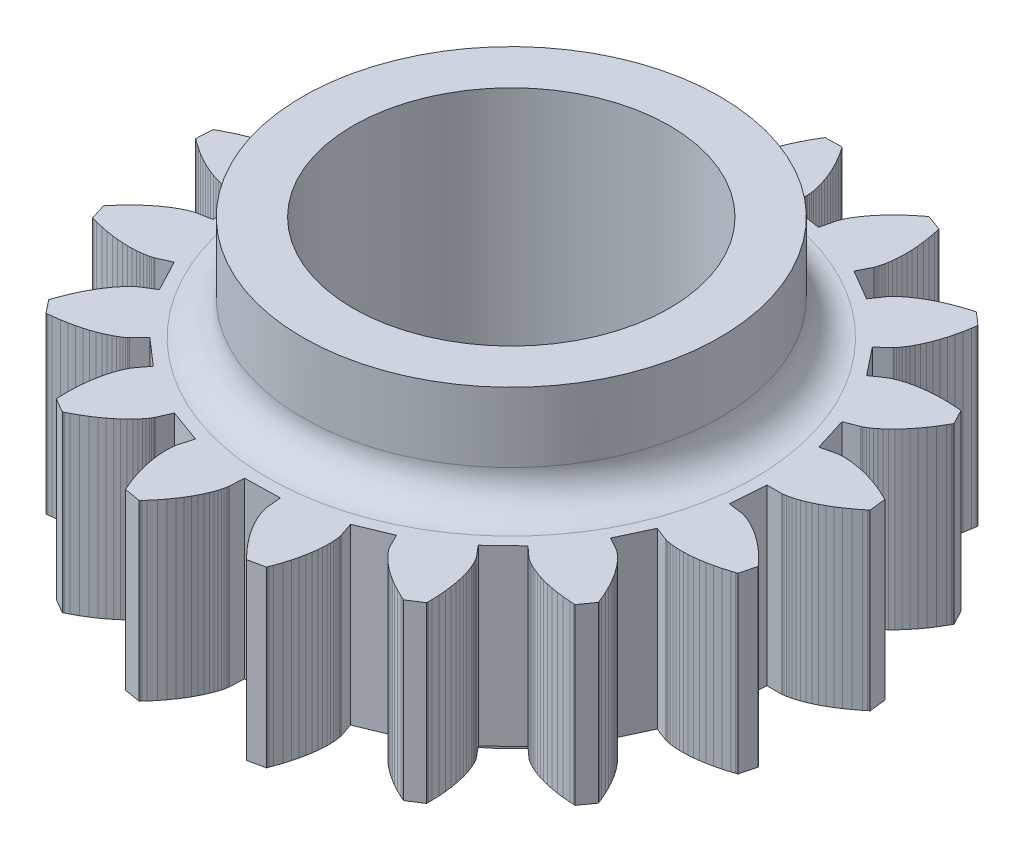
from build123d import *

# Parameters (mm, degrees)
BOSS_EXTRUDE1_DEPTH     = 5
SKETCH3_R               = 6
BOSS_EXTRUDE2_DEPTH     = 3
BOSS_EXTRUDE3_START     = -6
SKETCH3_2_R             = 6
BOSS_EXTRUDE3_DEPTH     = 1
CUT_EXTRUDE1_DEPTH      = 15.70772094
CUT_EXTRUDE1_DEPTH_BACK = 15.70772094
SKETCH2_R               = 4.55


with BuildPart() as part:
    # Sketch1 → Boss-Extrude1 (new body)
    with BuildSketch(Plane(origin=(0, 0, 0), x_dir=(1, 0, 0), z_dir=(0, 1, 0))):
        Polygon((7.35, 0), (7.766319, 1.4e-05), (7.778421, 0.000519), (7.803546, 0.002554), (7.841567, 0.007188), (7.89229, 0.015481), (7.955458, 0.02848), (8.030748, 0.047216), (8.117774, 0.072701), (8.216087, 0.105924), (8.325179, 0.147849), (8.444479, 0.199407), (8.573361, 0.2615), (8.711141, 0.334991), (8.85708, 0.420705), (9.010389, 0.519425), (9.170226, 0.631889), (9.335704, 0.758787), (9.420269, 0.82785), (9.44158, 0.845714), (9.45226, 0.854736), (9.457605, 0.85927), (9.46028, 0.861542), (9.405526, 1.336443), (9.401764, 1.33846), (9.395519, 1.341643), (9.383051, 1.347968), (9.358203, 1.360453), (9.260024, 1.40822), (9.069801, 1.493667), (8.888386, 1.566364), (8.716486, 1.627187), (8.554748, 1.677047), (8.403761, 1.716887), (8.264055, 1.747681), (8.136096, 1.770425), (8.020287, 1.786142), (7.916969, 1.795868), (7.826415, 1.800659), (7.748834, 1.801581), (7.68437, 1.799707), (7.633099, 1.796114), (7.595031, 1.791881), (7.570112, 1.788085), (7.558218, 1.785793), (7.153051, 1.690077), (6.853671, 2.655126), (7.241872, 2.805531), (7.252974, 2.810373), (7.275668, 2.821347), (7.309447, 2.839403), (7.353749, 2.86546), (7.407956, 2.900399), (7.471393, 2.945068), (7.543336, 3.00027), (7.623009, 3.066764), (7.709589, 3.145266), (7.802208, 3.236439), (7.899957, 3.340896), (8.001884, 3.459197), (8.107005, 3.591842), (8.214299, 3.739278), (8.322716, 3.901887), (8.43118, 4.079993), (8.485085, 4.174941), (8.498504, 4.199296), (8.505203, 4.211567), (8.50855, 4.217726), (8.510223, 4.220811), (8.287613, 4.643864), (8.283376, 4.644386), (8.276403, 4.645098), (8.262492, 4.646492), (8.234812, 4.649157), (8.126008, 4.658233), (7.917763, 4.669193), (7.722337, 4.671446), (7.540073, 4.666064), (7.371245, 4.654131), (7.216063, 4.636738), (7.074667, 4.614985), (6.947132, 4.589969), (6.833466, 4.562789), (6.733611, 4.534536), (6.647441, 4.506292), (6.574766, 4.479126), (6.515332, 4.454091), (6.468822, 4.432219), (6.434854, 4.414521), (6.412988, 4.401979), (6.402725, 4.395546), (6.059495, 4.15993), (5.431716, 4.951663), (5.73937, 5.232145), (5.747973, 5.240672), (5.76517, 5.259102), (5.790145, 5.288141), (5.822043, 5.328442), (5.859968, 5.380604), (5.902985, 5.445173), (5.950129, 5.522635), (6.000401, 5.613421), (6.052777, 5.717898), (6.106206, 5.836372), (6.159619, 5.969087), (6.211929, 6.116219), (6.262034, 6.277881), (6.308823, 6.45412), (6.351178, 6.644913), (6.387977, 6.850174), (6.403944, 6.958183), (6.407658, 6.985741), (6.409472, 6.999604), (6.410369, 7.006555), (6.410814, 7.010037), (6.050412, 7.324105), (6.046273, 7.323062), (6.039513, 7.321207), (6.026038, 7.317481), (5.999265, 7.309968), (5.894529, 7.279125), (5.696387, 7.214119), (5.513344, 7.145624), (5.345332, 7.074764), (5.192216, 7.002649), (5.053795, 6.930372), (4.929806, 6.85901), (4.81992, 6.789613), (4.723748, 6.723207), (4.640842, 6.66079), (4.570694, 6.603325), (4.51274, 6.55174), (4.466363, 6.506926), (4.430894, 6.469729), (4.405613, 6.440956), (4.389755, 6.421362), (4.382509, 6.411655), (4.147571, 6.067961), (3.276177, 6.57945), (3.461734, 6.95213), (3.466676, 6.963188), (3.476054, 6.986586), (3.488853, 7.022687), (3.504038, 7.071789), (3.520559, 7.134128), (3.537347, 7.209876), (3.553324, 7.299139), (3.567406, 7.401954), (3.578503, 7.518296), (3.585527, 7.648071), (3.587391, 7.791119), (3.583018, 7.947212), (3.571341, 8.116057), (3.551305, 8.297297), (3.521877, 8.490507), (3.482043, 8.6952), (3.457914, 8.801683), (3.451423, 8.828723), (3.448107, 8.842304), (3.446431, 8.849111), (3.445589, 8.852518), (2.996069, 9.015186), (2.992586, 9.012717), (2.986953, 9.008546), (2.975734, 9.000204), (2.953483, 8.983526), (2.866961, 8.916932), (2.705682, 8.784738), (2.559743, 8.654746), (2.428674, 8.527978), (2.311948, 8.40542), (2.208984, 8.288021), (2.119147, 8.176687), (2.04175, 8.072281), (1.976061, 7.975619), (1.921301, 7.887467), (1.876649, 7.808542), (1.841243, 7.739505), (1.814187, 7.680964), (1.79455, 7.633467), (1.78137, 7.597503), (1.773661, 7.573504), (1.770411, 7.561835), (1.675494, 7.156481), (0.678172, 7.318646), (0.716572, 7.733191), (0.717186, 7.745288), (0.717477, 7.770493), (0.716371, 7.808779), (0.712794, 7.860051), (0.705679, 7.924149), (0.69397, 8.000847), (0.676623, 8.089853), (0.652613, 8.190812), (0.620933, 8.303307), (0.580602, 8.426856), (0.530666, 8.560917), (0.470201, 8.70489), (0.398318, 8.858115), (0.314164, 9.019878), (0.216928, 9.189411), (0.10584, 9.365892), (0.044874, 9.456468), (0.029053, 9.479336), (0.021055, 9.490803), (0.017034, 9.496544), (0.015018, 9.499417), (-0.46291, 9.488715), (-0.465265, 9.485155), (-0.469011, 9.479231), (-0.476459, 9.467399), (-0.491183, 9.44381), (-0.547806, 9.350457), (-0.65044, 9.168929), (-0.739565, 8.994996), (-0.81599, 8.829441), (-0.88056, 8.672993), (-0.934162, 8.526327), (-0.977715, 8.390058), (-1.012169, 8.264743), (-1.038503, 8.150879), (-1.057722, 8.048898), (-1.070848, 7.959172), (-1.078924, 7.882008), (-1.083005, 7.817646), (-1.084158, 7.766262), (-1.083456, 7.727966), (-1.081975, 7.702802), (-1.080791, 7.690748), (-1.022867, 7.278478), (-2.011423, 7.069418), (-2.125367, 7.469841), (-2.129165, 7.481343), (-2.137998, 7.504952), (-2.15286, 7.540253), (-2.174718, 7.58677), (-2.204507, 7.64397), (-2.243132, 7.711258), (-2.29146, 7.787987), (-2.35032, 7.873456), (-2.420498, 7.96691), (-2.502736, 8.067546), (-2.597729, 8.174516), (-2.70612, 8.286924), (-2.8285, 8.403835), (-2.965407, 8.524275), (-3.117319, 8.647234), (-3.284657, 8.771668), (-3.374226, 8.834104), (-3.39724, 8.849713), (-3.40884, 8.857516), (-3.414664, 8.861417), (-3.417582, 8.863367), (-3.85937, 8.680741), (-3.86028, 8.676571), (-3.861633, 8.669693), (-3.864304, 8.65597), (-3.869512, 8.628654), (-3.888588, 8.521151), (-3.918716, 8.314806), (-3.938992, 8.120422), (-3.95045, 7.938439), (-3.954144, 7.76923), (-3.951145, 7.613105), (-3.94253, 7.470305), (-3.929389, 7.341006), (-3.912813, 7.225317), (-3.893893, 7.123281), (-3.87372, 7.034872), (-3.853376, 6.960001), (-3.833931, 6.898511), (-3.816445, 6.85018), (-3.801956, 6.814724), (-3.791485, 6.791795), (-3.786026, 6.780982), (-3.583085, 6.417476), (-4.429365, 5.865427), (-4.680264, 6.197648), (-4.68796, 6.207002), (-4.704725, 6.225825), (-4.731336, 6.253374), (-4.768521, 6.288854), (-4.816962, 6.33143), (-4.877286, 6.380221), (-4.950068, 6.434311), (-5.035828, 6.492746), (-5.135027, 6.554538), (-5.248066, 6.61867), (-5.375286, 6.684101), (-5.516964, 6.749763), (-5.673313, 6.814571), (-5.844483, 6.877422), (-6.030554, 6.9372), (-6.231544, 6.992782), (-6.337619, 7.018646), (-6.364717, 7.024887), (-6.378353, 7.027973), (-6.385193, 7.029506), (-6.388618, 7.030271), (-6.734601, 6.700385), (-6.733943, 6.696167), (-6.73272, 6.689265), (-6.730253, 6.675504), (-6.725242, 6.648151), (-6.704195, 6.541016), (-6.657748, 6.337722), (-6.606435, 6.14914), (-6.551379, 5.975307), (-6.4937, 5.816189), (-6.434503, 5.671691), (-6.374885, 5.541645), (-6.315923, 5.425825), (-6.258675, 5.323937), (-6.204173, 5.235625), (-6.153426, 5.160474), (-6.107408, 5.098008), (-6.067064, 5.047694), (-6.033299, 5.008944), (-6.006981, 4.981116), (-5.988934, 4.963518), (-5.979937, 4.955407), (-5.659387, 4.689759), (-6.249096, 3.869276), (-6.603065, 4.088428), (-6.61362, 4.09437), (-6.636053, 4.105866), (-6.670819, 4.121942), (-6.71831, 4.141593), (-6.778859, 4.163795), (-6.852735, 4.1875), (-6.940142, 4.211646), (-7.04122, 4.235154), (-7.156042, 4.256939), (-7.284615, 4.275906), (-7.42688, 4.290962), (-7.582711, 4.30101), (-7.751914, 4.304961), (-7.934229, 4.301734), (-8.12933, 4.290259), (-8.336826, 4.269481), (-8.445081, 4.25528), (-8.472604, 4.251311), (-8.486434, 4.249262), (-8.493365, 4.248222), (-8.496835, 4.247698), (-8.700286, 3.815104), (-8.69815, 3.811409), (-8.694516, 3.805415), (-8.687244, 3.793474), (-8.672691, 3.769779), (-8.614364, 3.677481), (-8.497615, 3.504694), (-8.381643, 3.347383), (-8.267509, 3.205176), (-8.156244, 3.07764), (-8.048846, 2.964283), (-7.946277, 2.864556), (-7.849457, 2.777857), (-7.759268, 2.703529), (-7.676545, 2.640869), (-7.602077, 2.589125), (-7.536602, 2.5475), (-7.480806, 2.515158), (-7.435323, 2.491222), (-7.40073, 2.474781), (-7.377544, 2.46489), (-7.366225, 2.460577), (-6.971358, 2.328664), (-7.224852, 1.350559), (-7.634085, 1.427044), (-7.646074, 1.428771), (-7.671145, 1.431387), (-7.70937, 1.433818), (-7.760753, 1.434987), (-7.825234, 1.433817), (-7.902685, 1.429234), (-7.992912, 1.420174), (-8.095656, 1.405581), (-8.210594, 1.384416), (-8.337337, 1.355657), (-8.475434, 1.318304), (-8.624371, 1.271381), (-8.783576, 1.213942), (-8.952414, 1.145073), (-9.130195, 1.063894), (-9.316173, 0.969564), (-9.411988, 0.917216), (-9.436219, 0.903572), (-9.448374, 0.896666), (-9.454462, 0.893192), (-9.457509, 0.891449), (-9.49095, 0.414573), (-9.487623, 0.411899), (-9.482069, 0.407623), (-9.470975, 0.399115), (-9.448845, 0.382277), (-9.361115, 0.317282), (-9.189831, 0.198337), (-9.024863, 0.093543), (-8.867066, 0.002169), (-8.717243, -0.076561), (-8.576148, -0.143467), (-8.444479, -0.199407), (-8.322878, -0.245277), (-8.211929, -0.282005), (-8.112157, -0.310551), (-8.024025, -0.3319), (-7.947935, -0.347061), (-7.884224, -0.357064), (-7.833166, -0.362953), (-7.794969, -0.365788), (-7.769776, -0.366635), (-7.757663, -0.366568), (-7.341808, -0.346931), (-7.224852, -1.350559), (-7.63408, -1.427071), (-7.645883, -1.429791), (-7.670207, -1.436408), (-7.706728, -1.44795), (-7.755064, -1.465422), (-7.814768, -1.489806), (-7.885333, -1.522058), (-7.966194, -1.5631), (-8.056729, -1.613823), (-8.15626, -1.675079), (-8.264055, -1.747681), (-8.379333, -1.832398), (-8.501263, -1.929955), (-8.628967, -2.041026), (-8.761526, -2.166236), (-8.897976, -2.306155), (-9.03732, -2.461298), (-9.107754, -2.544724), (-9.12542, -2.566199), (-9.13426, -2.57703), (-9.138681, -2.582469), (-9.140893, -2.585195), (-8.999808, -3.041949), (-8.99574, -3.04324), (-8.989016, -3.045222), (-8.975598, -3.049148), (-8.94888, -3.056854), (-8.843595, -3.085768), (-8.64091, -3.134806), (-8.449226, -3.17293), (-8.269076, -3.201131), (-8.10093, -3.220423), (-7.945194, -3.231841), (-7.802208, -3.236439), (-7.672249, -3.235284), (-7.555524, -3.229453), (-7.452177, -3.220029), (-7.362285, -3.2081), (-7.285856, -3.19475), (-7.222834, -3.181062), (-7.173096, -3.16811), (-7.136454, -3.156954), (-7.112656, -3.148644), (-7.101386, -3.144206), (-6.720706, -2.97567), (-6.249096, -3.869276), (-6.60305, -4.088452), (-6.613074, -4.095252), (-6.633364, -4.110209), (-6.66325, -4.134164), (-6.702011, -4.167918), (-6.748874, -4.212223), (-6.803024, -4.267787), (-6.863598, -4.335269), (-6.929696, -4.415271), (-7.000378, -4.508345), (-7.074667, -4.614985), (-7.151557, -4.735625), (-7.230011, -4.87064), (-7.308969, -5.020342), (-7.387345, -5.184983), (-7.464036, -5.364745), (-7.537926, -5.559749), (-7.573467, -5.662985), (-7.582182, -5.689391), (-7.586513, -5.702684), (-7.588671, -5.709353), (-7.589748, -5.712693), (-7.293193, -6.087638), (-7.288932, -6.087373), (-7.281947, -6.086792), (-7.268017, -6.085605), (-7.240319, -6.083139), (-7.131699, -6.072068), (-6.924986, -6.044576), (-6.732474, -6.010882), (-6.554302, -5.972101), (-6.390542, -5.929348), (-6.241197, -5.883737), (-6.106206, -5.836372), (-5.985439, -5.788349), (-5.878703, -5.740745), (-5.78574, -5.694625), (-5.706227, -5.651028), (-5.639781, -5.610971), (-5.585959, -5.575441), (-5.544259, -5.545395), (-5.514122, -5.521757), (-5.494933, -5.50541), (-5.486027, -5.497201), (-5.191936, -5.202529), (-4.429365, -5.865427), (-4.680242, -6.197665), (-4.687132, -6.207627), (-4.700649, -6.228903), (-4.719864, -6.262037), (-4.743813, -6.307513), (-4.771507, -6.365755), (-4.801928, -6.437129), (-4.834035, -6.521935), (-4.866769, -6.620413), (-4.899055, -6.732735), (-4.929806, -6.85901), (-4.957923, -6.999279), (-4.982307, -7.153517), (-5.001853, -7.321634), (-5.015462, -7.503469), (-5.022037, -7.698797), (-5.020494, -7.907324), (-5.016342, -8.016428), (-5.014929, -8.0442), (-5.014165, -8.058159), (-5.013769, -8.065158), (-5.013567, -8.068661), (-4.601591, -8.311159), (-4.597714, -8.309372), (-4.591411, -8.306307), (-4.57885, -8.300169), (-4.553913, -8.287863), (-4.456627, -8.238301), (-4.273804, -8.137993), (-4.106464, -8.037031), (-3.954333, -7.936505), (-3.817075, -7.837483), (-3.694292, -7.741002), (-3.585527, -7.648071), (-3.490263, -7.559664), (-3.407931, -7.476718), (-3.337906, -7.40013), (-3.279511, -7.330753), (-3.232023, -7.269398), (-3.194671, -7.216825), (-3.16664, -7.173745), (-3.147077, -7.140816), (-3.135089, -7.118641), (-3.12975, -7.107769), (-2.961966, -6.726757), (-2.011423, -7.069418), (-2.125341, -7.469849), (-2.128167, -7.481627), (-2.133085, -7.50635), (-2.139033, -7.544187), (-2.144938, -7.595244), (-2.149722, -7.659557), (-2.152305, -7.7371), (-2.151609, -7.827778), (-2.146558, -7.931431), (-2.136089, -8.047831), (-2.119147, -8.176687), (-2.094695, -8.317641), (-2.061714, -8.470273), (-2.01921, -8.634098), (-1.966213, -8.80857), (-1.901784, -8.993083), (-1.825016, -9.186972), (-1.781732, -9.287208), (-1.770382, -9.312594), (-1.764627, -9.325335), (-1.761729, -9.331718), (-1.760275, -9.334912), (-1.288519, -9.412211), (-1.285549, -9.409145), (-1.280779, -9.404009), (-1.271283, -9.393748), (-1.252476, -9.373266), (-1.179663, -9.291907), (-1.045422, -9.132329), (-0.925853, -8.977734), (-0.820309, -8.82904), (-0.728091, -8.687121), (-0.648452, -8.552802), (-0.580602, -8.426856), (-0.523708, -8.310006), (-0.476899, -8.202919), (-0.439269, -8.106206), (-0.40988, -8.02042), (-0.387762, -7.946053), (-0.371924, -7.883537), (-0.361348, -7.83324), (-0.355002, -7.795467), (-0.351834, -7.77046), (-0.350783, -7.758393), (-0.331966, -7.342499), (0.678172, -7.318646), (0.716599, -7.733188), (0.718218, -7.745192), (0.722563, -7.770022), (0.730686, -7.807453), (0.743624, -7.857195), (0.762395, -7.918894), (0.787998, -7.992134), (0.821404, -8.076437), (0.863557, -8.171265), (0.915368, -8.276023), (0.977715, -8.390058), (1.051434, -8.512661), (1.137324, -8.643072), (1.236139, -8.78048), (1.348583, -8.924025), (1.475316, -9.072804), (1.61694, -9.225868), (1.693511, -9.303699), (1.713265, -9.323271), (1.723234, -9.333073), (1.728242, -9.337978), (1.730751, -9.340431), (2.198575, -9.242092), (2.200236, -9.23816), (2.202829, -9.231648), (2.207977, -9.21865), (2.218115, -9.192756), (2.25662, -9.090588), (2.324151, -8.893293), (2.379799, -8.705944), (2.424502, -8.529165), (2.459225, -8.363516), (2.484965, -8.209498), (2.502736, -8.067546), (2.513577, -7.938035), (2.518541, -7.82127), (2.518693, -7.717494), (2.515109, -7.626885), (2.508868, -7.54955), (2.501053, -7.485534), (2.492745, -7.434813), (2.485018, -7.397298), (2.478939, -7.372835), (2.47556, -7.361203), (2.342868, -6.966597), (3.276177, -6.57945), (3.461759, -6.952118), (3.467605, -6.962726), (3.480626, -6.98431), (3.501722, -7.016279), (3.531754, -7.057988), (3.571547, -7.108739), (3.621878, -7.167785), (3.683482, -7.234327), (3.757045, -7.307525), (3.8432, -7.386493), (3.94253, -7.470305), (4.055561, -7.557998), (4.182761, -7.648575), (4.32454, -7.741009), (4.481246, -7.834241), (4.653166, -7.927192), (4.84052, -8.018759), (4.940036, -8.063674), (4.965526, -8.074789), (4.978363, -8.080327), (4.984804, -8.083092), (4.98803, -8.084473), (5.388739, -7.823778), (5.388867, -7.819511), (5.388933, -7.812502), (5.389037, -7.798522), (5.389138, -7.770714), (5.388135, -7.661536), (5.379834, -7.453168), (5.364046, -7.258369), (5.34187, -7.077378), (5.31441, -6.910372), (5.282773, -6.757456), (5.248066, -6.61867), (5.21139, -6.493988), (5.173838, -6.383315), (5.136492, -6.286492), (5.100417, -6.203296), (5.066662, -6.133438), (5.03625, -6.076568), (5.01018, -6.032273), (4.989423, -6.000083), (4.974917, -5.979468), (4.967564, -5.969842), (4.701284, -5.649817), (5.431716, -4.951663), (5.739388, -5.232125), (5.748672, -5.239905), (5.768611, -5.255328), (5.79983, -5.277517), (5.842902, -5.305561), (5.898341, -5.338511), (5.966603, -5.375387), (6.048085, -5.415182), (6.143122, -5.456863), (6.251986, -5.499375), (6.374885, -5.541645), (6.511962, -5.582586), (6.663293, -5.621096), (6.828888, -5.656072), (7.008692, -5.6864), (7.20258, -5.71097), (7.41036, -5.728673), (7.519382, -5.734606), (7.547165, -5.735761), (7.561136, -5.736289), (7.568141, -5.73654), (7.571648, -5.736662), (7.851124, -5.348818), (7.849702, -5.344793), (7.847232, -5.338234), (7.842279, -5.32516), (7.832327, -5.299194), (7.791952, -5.197751), (7.708941, -5.006452), (7.623849, -4.83051), (7.537789, -4.669753), (7.451854, -4.523944), (7.367114, -4.392782), (7.284615, -4.275906), (7.205375, -4.172892), (7.13038, -4.083258), (7.060579, -4.006465), (6.996887, -3.941918), (6.940175, -3.888971), (6.891272, -3.846927), (6.850962, -3.815041), (6.819978, -3.792523), (6.799005, -3.778541), (6.788671, -3.772221), (6.424766, -3.569997), (6.853671, -2.655126), (7.241882, -2.805505), (7.253349, -2.809406), (7.277513, -2.816585), (7.31464, -2.825998), (7.364934, -2.836588), (7.428532, -2.847286), (7.505506, -2.857013), (7.595861, -2.864687), (7.699537, -2.869222), (7.816407, -2.869537), (7.946277, -2.864556), (8.088886, -2.853214), (8.24391, -2.834457), (8.410957, -2.807251), (8.589575, -2.770578), (8.779246, -2.723449), (8.97939, -2.664898), (9.083193, -2.631047), (9.109518, -2.622088), (9.122736, -2.617533), (9.129358, -2.615236), (9.132673, -2.614083), (9.253171, -2.151472), (9.250392, -2.148232), (9.245718, -2.143008), (9.236377, -2.132606), (9.217717, -2.111989), (9.143423, -2.03198), (8.996912, -1.883587), (8.854009, -1.750264), (8.715689, -1.631451), (8.582884, -1.526532), (8.456485, -1.434839), (8.337337, -1.355657), (8.226235, -1.288224), (8.123924, -1.231735), (8.031096, -1.185342), (7.948387, -1.148162), (7.876379, -1.119277), (7.81559, -1.097738), (7.766484, -1.082567), (7.729458, -1.072762), (7.70485, -1.0673), (7.692931, -1.065141), (7.280548, -1.00803), align=None)
    extrude(amount=BOSS_EXTRUDE1_DEPTH)

    # Sketch3 → Boss-Extrude2 (add)
    with BuildSketch(Plane(origin=(0, 5, 0), x_dir=(1, 0, 0), z_dir=(0, 1, 0))):
        with Locations(Location((0, 0, 0), (0, 0, 90))):
            Circle(SKETCH3_R)
    extrude(amount=BOSS_EXTRUDE2_DEPTH)

    # Sketch3<2> → Boss-Extrude3 (add)
    with BuildSketch(Plane(origin=(0, 5, 0), x_dir=(1, 0, 0), z_dir=(0, 1, 0)).offset(BOSS_EXTRUDE3_START)):
        with Locations(Location((0, 0, 0), (0, 0, 90))):
            Circle(SKETCH3_2_R)
    extrude(amount=BOSS_EXTRUDE3_DEPTH)

    # Sketch2 → Cut-Extrude1 (cut, two sides: drawn at the far end of the back side and taken through both)
    with BuildSketch(Plane(origin=(0, 5, 0), x_dir=(1, 0, 0), z_dir=(0, 1, 0)).offset(-CUT_EXTRUDE1_DEPTH_BACK)):
        with Locations(Location((0, 0, 0), (0, 0, 270))):
            Circle(SKETCH2_R)
    extrude(amount=CUT_EXTRUDE1_DEPTH + CUT_EXTRUDE1_DEPTH_BACK, mode=Mode.SUBTRACT)

    # Fillet1: read off the stored shape, not the designer's step
    # Fillet1 outline → Fillet1 (revolve)
    with BuildSketch(Plane.XY):
        with BuildLine():
            Line((6, 5), (7, 5))
            ThreePointArc((7, 5), (6.292893219, 5.292893219), (6, 6))
            Line((6, 6), (6, 5))
        make_face()
        with BuildLine():
            ThreePointArc((6, -1), (6.292893219, -0.292893219), (7, 0))
            Line((7, 0), (6, 0))
            Line((6, 0), (6, -1))
        make_face()
    revolve(axis=Axis((0, 0, 0), (0, 1, 0)))


solid = part.part
